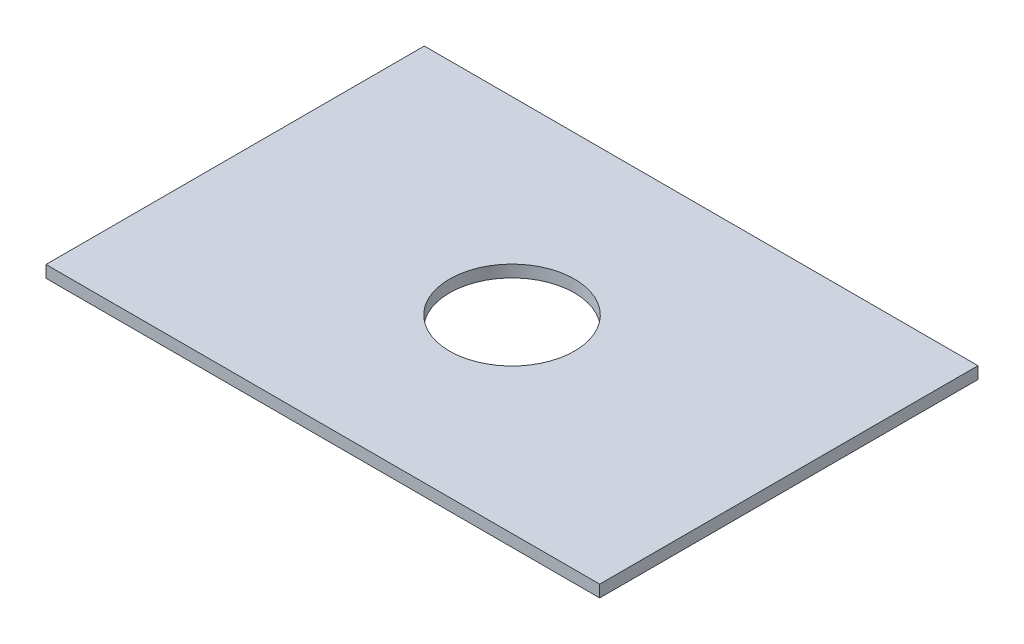
from build123d import *

# Parameters (mm, degrees)
SKETCH1_W           = 146.35
SKETCH1_H           = 100
BOSS_EXTRUDE1_DEPTH = 3.175
SKETCH2_R           = 16.51
CUT_EXTRUDE1_DEPTH  = 10


with BuildPart() as part:
    # Sketch1 → Boss-Extrude1 (new body)
    with BuildSketch(Plane(origin=(0, 0, 0), x_dir=(1, 0, 0), z_dir=(0, 1, 0))):
        with Locations((73.175, 50)):
            Rectangle(SKETCH1_W, SKETCH1_H)
    extrude(amount=BOSS_EXTRUDE1_DEPTH)

    # Sketch2 → Cut-Extrude1 (cut)
    with BuildSketch(Plane(origin=(0, 3.175, 0), x_dir=(1, 0, 0), z_dir=(0, 1, 0))):
        with Locations((73.175, 50)):
            Circle(SKETCH2_R)
    extrude(amount=-CUT_EXTRUDE1_DEPTH, mode=Mode.SUBTRACT)


solid = part.part
